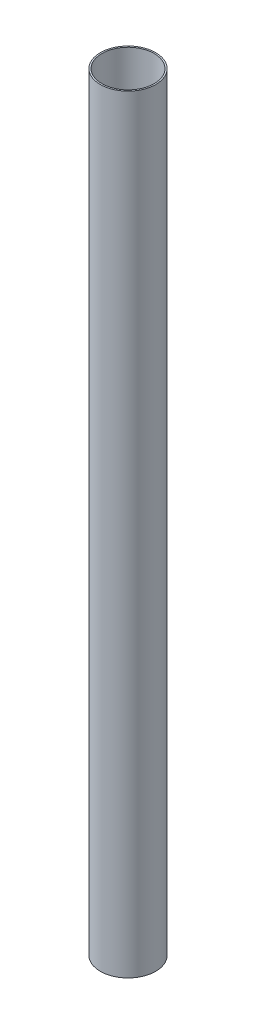
from build123d import *

# Parameters (mm, degrees)
SKETCH1_W = 1.4732
SKETCH1_H = 749.3


with BuildPart() as part:
    # Sketch1 → Revolve1 (revolve)
    with BuildSketch(Plane.XY):
        with Locations((26.2509, -289.61446278)):
            Rectangle(SKETCH1_W, SKETCH1_H)
    revolve(axis=Axis((0, 0, 0), (0, 1, 0)))


solid = part.part
